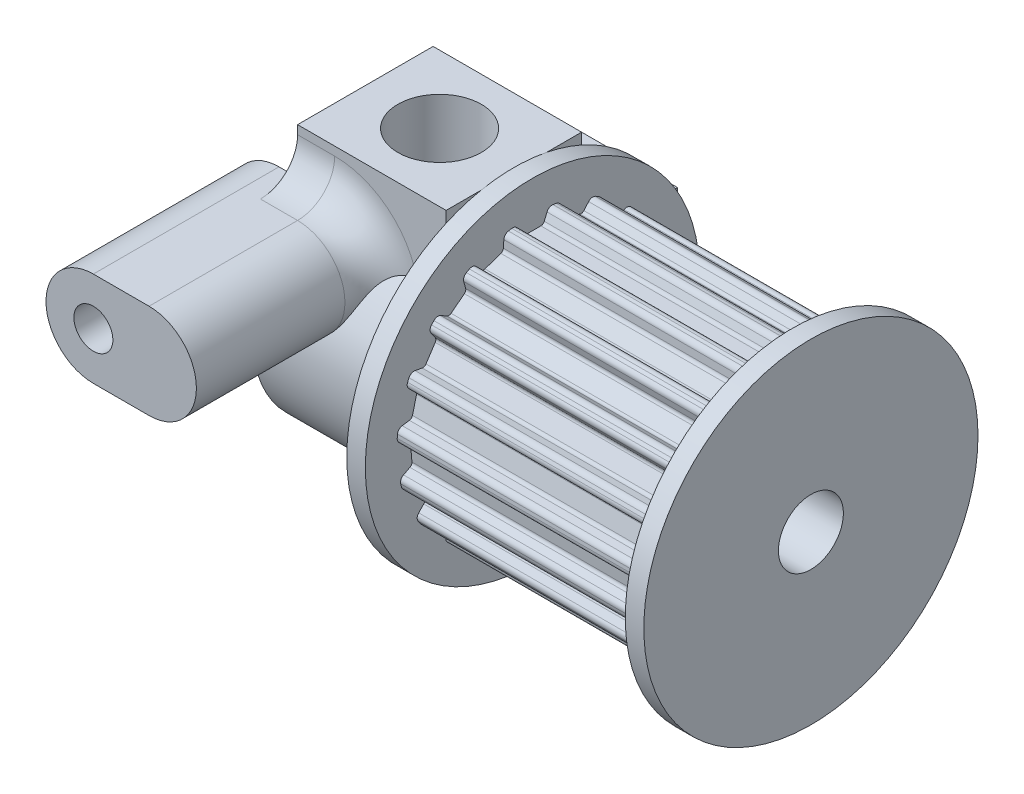
from build123d import *

# Parameters (mm, degrees)
SKETCH1_R           = 1.75
BOSS_EXTRUDE1_DEPTH = 4
SKETCH2_R           = 2.25
CUT_EXTRUDE1_DEPTH  = 5
SKETCH7_R           = 7.3
SKETCH7_R_2         = 1.75
BOSS_EXTRUDE5_DEPTH = 15
CUT_EXTRUDE3_START  = -15
CUT_EXTRUDE3_DEPTH  = 15
CIRPATTERN1_COUNT   = 19
SKETCH9_R           = 9
SKETCH9_R_2         = 1.75
BOSS_EXTRUDE6_DEPTH = 1
SKETCH10_R          = 9
SKETCH10_R_2        = 1.75
BOSS_EXTRUDE7_DEPTH = 1
SKETCH3_R           = 2.25
CUT_EXTRUDE2_DEPTH  = 5
BOSS_EXTRUDE2_START = 4
SKETCH4_W           = 8
SKETCH4_H           = 7.3
SKETCH4_R           = 2.25
BOSS_EXTRUDE2_DEPTH = 4
BOSS_EXTRUDE3_START = 4
SKETCH5_W           = 8
SKETCH5_H           = 7.3
SKETCH5_R           = 2.25
BOSS_EXTRUDE3_DEPTH = 4
SKETCH6_R           = 1.0505
BOSS_EXTRUDE4_DEPTH = 10
FILLET1_R           = 2


with BuildPart() as part:
    # Sketch1 → Boss-Extrude1 (new, symmetric)
    with BuildSketch(Plane(origin=(0, 0, 0), x_dir=(0, 0, -1), z_dir=(1, 0, 0))):
        with BuildLine():
            Line((-3.65, 4.824935233), (3.65, 4.824935233))
            ThreePointArc((3.65, 4.824935233), (4.277996026, 4.277996026), (4.824935233, 3.65))
            Line((4.824935233, 3.65), (4.824935233, -3.65))
            ThreePointArc((4.824935233, -3.65), (-4.277996026, -4.277996026), (-3.65, 4.824935233))
        make_face()
        Circle(SKETCH1_R, mode=Mode.SUBTRACT)
    extrude(amount=BOSS_EXTRUDE1_DEPTH, both=True)

    # Sketch2 → Cut-Extrude1 (cut)
    with BuildSketch(Plane(origin=(0, 4.824935233, 0), x_dir=(1, 0, 0), z_dir=(0, 1, 0))):
        with Locations(Location((0, 0, 0), (0, 0, 270))):
            Circle(SKETCH2_R)
    extrude(amount=-CUT_EXTRUDE1_DEPTH, mode=Mode.SUBTRACT)

    # Sketch7 → Boss-Extrude5 (add)
    with BuildSketch(Plane(origin=(4, 0, 0), x_dir=(0, 0, -1), z_dir=(1, 0, 0))):
        Circle(SKETCH7_R)
        Circle(SKETCH7_R_2, mode=Mode.SUBTRACT)
    extrude(amount=BOSS_EXTRUDE5_DEPTH)

    # Sketch8 → Cut-Extrude3 (cut)
    with BuildSketch(Plane(origin=(19, 0, 0), x_dir=(0, 0, -1), z_dir=(1, 0, 0)).offset(CUT_EXTRUDE3_START)):
        with BuildLine():
            Line((-0.454130838, 6.549894534), (0.452760329, 6.549894534))
            ThreePointArc((0.452760329, 6.549894534), (0.563806886, 6.583637432), (0.637417439, 6.673367066))
            Line((0.637417439, 6.673367066), (0.786506247, 7.03329929))
            ThreePointArc((0.786506247, 7.03329929), (0.916480179, 7.180062711), (1.1093452, 7.215216783))
            ThreePointArc((1.1093452, 7.215216783), (-0.000740572, 7.299999962), (-1.110809118, 7.214991553))
            ThreePointArc((-1.110809118, 7.214991553), (-0.918007937, 7.179916572), (-0.787995556, 7.033290073))
            Line((-0.787995556, 7.033290073), (-0.638906747, 6.673357849))
            ThreePointArc((-0.638906747, 6.673357849), (-0.565244886, 6.583600612), (-0.454130838, 6.549894534))
        make_face()
    cut_extrude3 = extrude(amount=CUT_EXTRUDE3_DEPTH, mode=Mode.SUBTRACT)

    # CirPattern1: Cut-Extrude3 ×19 about axis
    cirpattern1_axis = Axis((0, 0, 0), (1, 0, 0))
    for i in range(1, CIRPATTERN1_COUNT):
        add(cut_extrude3.rotate(cirpattern1_axis, i * 360 / CIRPATTERN1_COUNT), mode=Mode.SUBTRACT)

    # Sketch9 → Boss-Extrude6 (add)
    with BuildSketch(Plane(origin=(19, 0, 0), x_dir=(0, 0, -1), z_dir=(1, 0, 0))):
        Circle(SKETCH9_R)
        Circle(SKETCH9_R_2, mode=Mode.SUBTRACT)
    extrude(amount=BOSS_EXTRUDE6_DEPTH)

    # Sketch10 → Boss-Extrude7 (add)
    with BuildSketch(Plane.ZY.offset(-4)):
        with Locations(Location((0, 0, 0), (0, 0, 180))):
            Circle(SKETCH10_R)
        with Locations(Location((0, 0, 0), (0, 0, 180))):
            Circle(SKETCH10_R_2, mode=Mode.SUBTRACT)
    extrude(amount=-BOSS_EXTRUDE7_DEPTH)

    # Sketch3 → Cut-Extrude2 (cut)
    with BuildSketch(Plane(origin=(0, 0, -4.824935233), x_dir=(-1, 0, 0), z_dir=(0, 0, -1))):
        Circle(SKETCH3_R)
    extrude(amount=-CUT_EXTRUDE2_DEPTH, mode=Mode.SUBTRACT)

    # Sketch4 → Boss-Extrude2 (add)
    with BuildSketch(Plane(origin=(0, 4.824935233, 0), x_dir=(1, 0, 0), z_dir=(0, 1, 0)).offset(BOSS_EXTRUDE2_START)):
        Rectangle(SKETCH4_W, SKETCH4_H)
        with Locations(Location((0, 0, 0), (0, 0, 270))):
            Circle(SKETCH4_R, mode=Mode.SUBTRACT)
    extrude(amount=-BOSS_EXTRUDE2_DEPTH)

    # Sketch5 → Boss-Extrude3 (add)
    with BuildSketch(Plane(origin=(0, 0, -4.824935233), x_dir=(-1, 0, 0), z_dir=(0, 0, -1)).offset(BOSS_EXTRUDE3_START)):
        Rectangle(SKETCH5_W, SKETCH5_H)
        Circle(SKETCH5_R, mode=Mode.SUBTRACT)
    extrude(amount=-BOSS_EXTRUDE3_DEPTH)

    # Sketch6 → Boss-Extrude4 (add)
    with BuildSketch(Plane.XY.offset(3.65)):
        with BuildLine():
            Line((-2, 6.3555), (-5, 6.3555))
            ThreePointArc((-5, 6.3555), (-7.5505, 3.805), (-5, 1.2545))
            Line((-5, 1.2545), (-2, 1.2545))
            ThreePointArc((-2, 1.2545), (0.5505, 3.805), (-2, 6.3555))
        make_face()
        with Locations(Location((-5, 3.805, 0), (0, 0, 342.162227247))):
            Circle(SKETCH6_R, mode=Mode.SUBTRACT)
    extrude(amount=BOSS_EXTRUDE4_DEPTH)

    # Fillet1
    # the kernel refuses this fillet: 2 mm, written as the material it adds along each edge
    with BuildSketch(Plane(origin=(-2, 3.805, 3.65), x_dir=(0.021369397119759107, -0.9997716483611335, 0), z_dir=(-0.9997716483611335, -0.021369397119759107, 0))) as fillet1_piece_1:
        with BuildLine():
            CenterArc((2.5505 + FILLET1_R, FILLET1_R), FILLET1_R, 180, 90)
            Line((2.5505 + FILLET1_R, 0), (2.5505, 0))
            Line((2.5505, 0), (2.5505, FILLET1_R))
        make_face()
    revolve(axis=Axis((-2, 3.805, 3.65), (0, 0, 1)), revolution_arc=178.77553053)
    with BuildSketch(Plane(origin=(-2, 6.3555, 3.65), x_dir=(0, 0, 1), z_dir=(-1, 0, 0))) as fillet1_piece_2:
        with BuildLine():
            CenterArc((FILLET1_R, FILLET1_R), FILLET1_R, 180, 90)
            Line((0, FILLET1_R), (0, 0))
            Line((0, 0), (FILLET1_R, 0))
        make_face()
    extrude(amount=2)


solid = part.part
